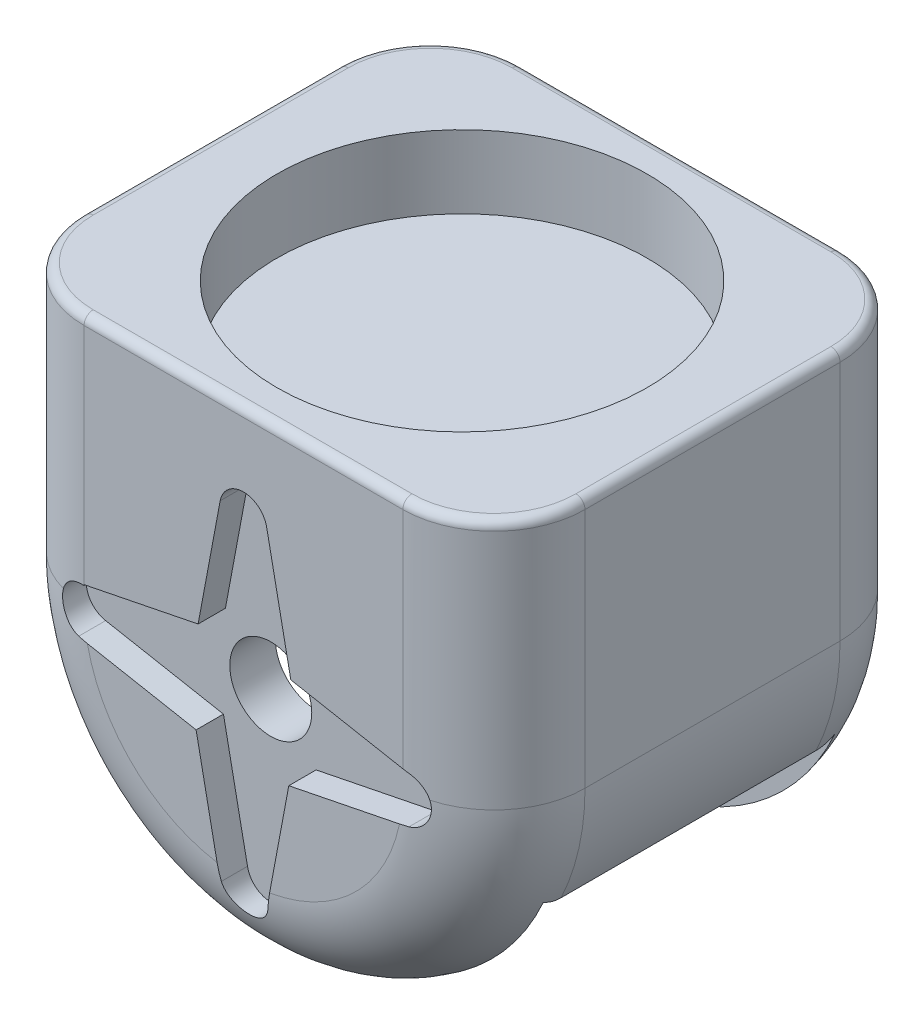
from build123d import *

# Parameters (mm, degrees)
BOSS_EXTRUDE1_DEPTH = 24
SKETCH3_R           = 20.325
CUT_EXTRUDE1_DEPTH  = 8
FILLET1_R           = 10
FILLET5_R           = 1
CUT_EXTRUDE2_DEPTH  = 16
SKETCH10_R          = 4.5
CUT_EXTRUDE4_DEPTH  = 75
CUT_EXTRUDE5_DEPTH  = 3
SKETCH12_R          = 7.5
CUT_EXTRUDE6_DEPTH  = 10


with BuildPart() as part:
    # Sketch2 → Boss-Extrude1 (new, symmetric)
    with BuildSketch(Plane.XY):
        with BuildLine():
            Line((-27.5, -27.5), (-27.5, 0))
            Line((-27.5, 0), (27.5, 0))
            Line((27.5, 0), (27.5, -27.5))
            ThreePointArc((27.5, -27.5), (0, -55), (-27.5, -27.5))
        make_face()
    extrude(amount=BOSS_EXTRUDE1_DEPTH, both=True)

    # Sketch3 → Cut-Extrude1 (cut)
    with BuildSketch(Plane(origin=(0, 0, 0), x_dir=(1, 0, 0), z_dir=(0, 1, 0))):
        Circle(SKETCH3_R)
    extrude(amount=-CUT_EXTRUDE1_DEPTH, mode=Mode.SUBTRACT)

    # Fillet1
    fillet1_edges = [part.edges().sort_by_distance(p)[0] for p in [
        (27.5, -13.75, -24),
        (0, -55, -24),
        (27.5, -13.75, 24),
        (0, -55, 24),
        (-27.5, -13.75, -24),
        (-27.5, -13.75, 24),
    ]]
    fillet(fillet1_edges, radius=FILLET1_R)

    # Fillet5
    fillet5_edges = [part.edges().sort_by_distance(p)[0] for p in [
        (24.571067812, 0, 21.071067812),
        (0, 0, 24),
        (0, 0, -24),
        (24.571067812, 0, -21.071067812),
        (-24.571067812, 0, 21.071067812),
        (-24.571067812, 0, -21.071067812),
        (27.5, 0, 0),
        (-27.5, 0, 0),
    ]]
    fillet(fillet5_edges, radius=FILLET5_R)

    # Sketch7 → Cut-Extrude2 (cut, symmetric)
    with BuildSketch(Plane.XY):
        with BuildLine():
            Line((-0.011296589, -11.876404256), (-25.011296589, -11.876404256))
            Line((-25.011296589, -11.876404256), (-25.011296589, -36.876404256))
            ThreePointArc((-25.011296589, -36.876404256), (-0.011296589, -61.876404256), (24.988703411, -36.876404256))
            Line((24.988703411, -36.876404256), (24.988703411, -11.876404256))
            Line((24.988703411, -11.876404256), (-0.011296589, -11.876404256))
        make_face()
    extrude(amount=CUT_EXTRUDE2_DEPTH, both=True, mode=Mode.SUBTRACT)

    # Sketch10 → Cut-Extrude4 (cut)
    with BuildSketch(Plane.XY.offset(24)):
        with Locations((0, -28.319318025)):
            Circle(SKETCH10_R)
    extrude(amount=-CUT_EXTRUDE4_DEPTH, mode=Mode.SUBTRACT)

    # Sketch11 → Cut-Extrude5 (cut)
    with BuildSketch(Plane.XY.offset(24)):
        with BuildLine():
            Line((5.197589428, -23.341260326), (2.555542026, -10.190564483))
            ThreePointArc((2.555542026, -10.190564483), (0, -8.069318025), (-2.555542026, -10.190564483))
            Line((-2.555542026, -10.190564483), (-4.978057698, -23.121728597))
            Line((-4.978057698, -23.121728597), (-17.5, -25.637455941))
            Line((-17.5, -25.637455941), (-17.5, -25.723648554))
            ThreePointArc((-17.5, -25.723648554), (-20.230845732, -28.004301665), (-18.128753541, -30.874860051))
            Line((-18.128753541, -30.874860051), (-5.197589428, -33.297375723))
            Line((-5.197589428, -33.297375723), (-2.555542026, -46.448071566))
            ThreePointArc((-2.555542026, -46.448071566), (0, -48.569318025), (2.555542026, -46.448071566))
            Line((2.555542026, -46.448071566), (4.978057698, -33.516907452))
            Line((4.978057698, -33.516907452), (18.128753541, -30.874860051))
            ThreePointArc((18.128753541, -30.874860051), (20.25, -28.319318025), (18.128753541, -25.763775998))
            Line((18.128753541, -25.763775998), (5.197589428, -23.341260326))
        make_face()
    extrude(amount=-CUT_EXTRUDE5_DEPTH, mode=Mode.SUBTRACT)

    # Sketch12 → Cut-Extrude6 (cut)
    with BuildSketch(Plane(origin=(0, 0, -24), x_dir=(-1, 0, 0), z_dir=(0, 0, -1))):
        with Locations((0, -28.319318025)):
            Circle(SKETCH12_R)
    extrude(amount=-CUT_EXTRUDE6_DEPTH, mode=Mode.SUBTRACT)


solid = part.part
